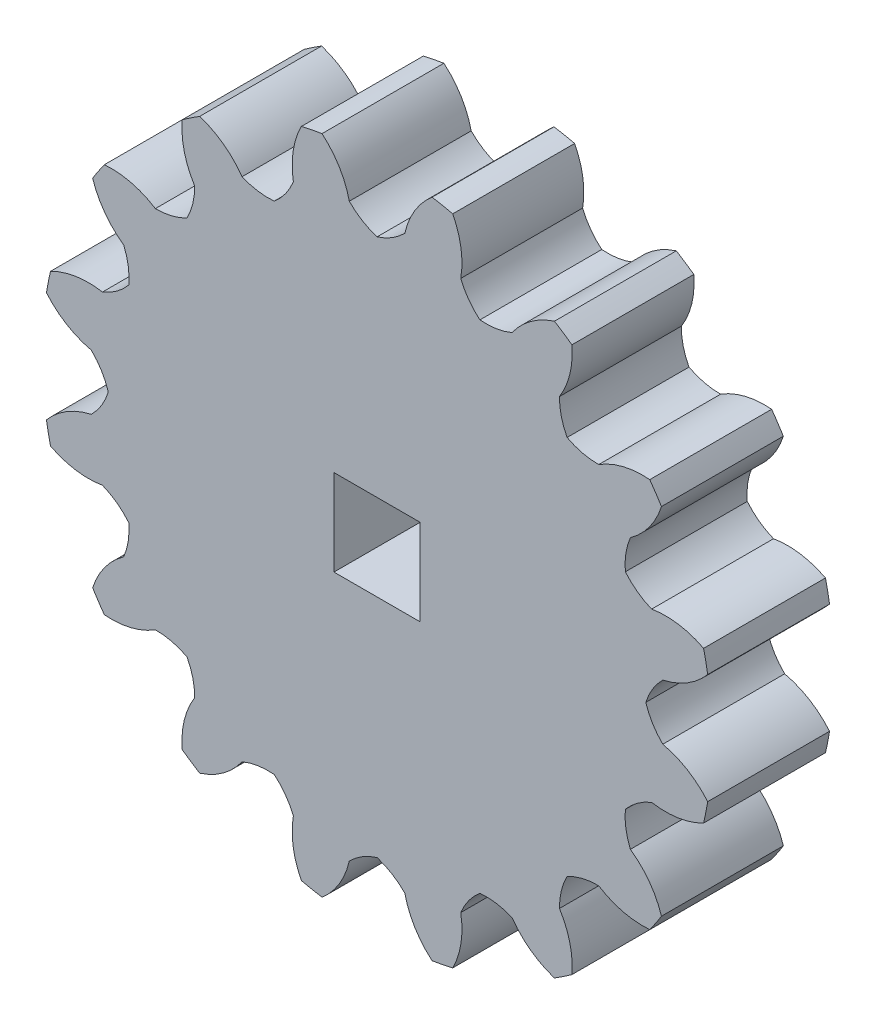
from build123d import *

# Parameters (mm, degrees)
SKETCH1_R           = 27.5
SKETCH1_W           = 7.071067812
SKETCH1_H           = 7.071067812
BOSS_EXTRUDE1_DEPTH = 10
CUT_EXTRUDE1_DEPTH  = 41.155946011
CIRPATTERN1_COUNT   = 16


with BuildPart() as part:
    # Sketch1 → Boss-Extrude1 (new body)
    with BuildSketch(Plane.XY):
        Circle(SKETCH1_R)
        Rectangle(SKETCH1_W, SKETCH1_H, mode=Mode.SUBTRACT)
    extrude(amount=BOSS_EXTRUDE1_DEPTH)

    # Sketch2 → Cut-Extrude1 (cut, through all)
    with BuildSketch(Plane.XY):
        with BuildLine():
            ThreePointArc((0, 22.049491893), (-1.225707934, 22.603476755), (-2.278022586, 23.441267324))
            ThreePointArc((-2.278022586, 23.441267324), (-3.702187854, 26.311049774), (-6.284648827, 28.2070438))
            ThreePointArc((-6.284648827, 28.2070438), (-3.428223208, 30.403864452), (0, 31.514032875))
            ThreePointArc((0, 31.514032875), (3.428223208, 30.403864452), (6.284648827, 28.2070438))
            ThreePointArc((6.284648827, 28.2070438), (3.702187854, 26.311049774), (2.278022586, 23.441267324))
            ThreePointArc((2.278022586, 23.441267324), (1.225707934, 22.603476755), (0, 22.049491893))
        make_face()
    cut_extrude1 = extrude(amount=CUT_EXTRUDE1_DEPTH, mode=Mode.SUBTRACT)

    # CirPattern1: Cut-Extrude1 ×16 about axis
    cirpattern1_axis = Axis((0, 0, 10), (0, 0, -1))
    for i in range(1, CIRPATTERN1_COUNT):
        add(cut_extrude1.rotate(cirpattern1_axis, i * 360 / CIRPATTERN1_COUNT), mode=Mode.SUBTRACT)


solid = part.part
